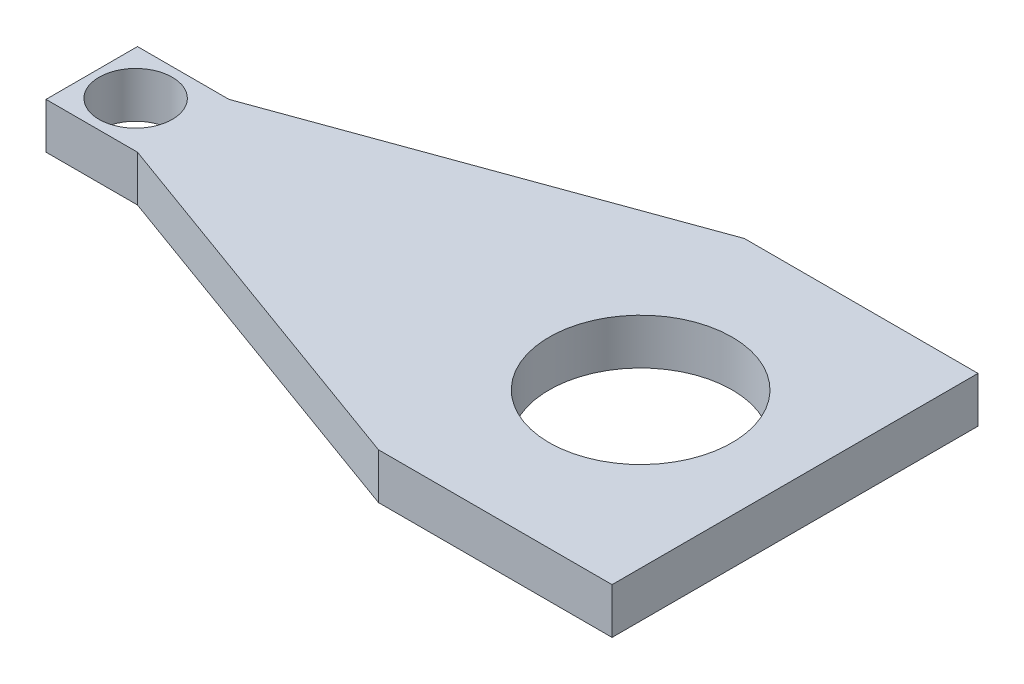
from build123d import *

# Parameters (mm, degrees)
SKETCH1_R           = 1.27
SKETCH1_R_2         = 3.175
BOSS_EXTRUDE1_DEPTH = 1.5875


with BuildPart() as part:
    # Sketch1 → Boss-Extrude1 (new body)
    with BuildSketch(Plane(origin=(0, 0, 0), x_dir=(1, 0, 0), z_dir=(0, 1, 0))):
        Polygon((-19.05, -1.5875), (-15.875, -1.5875), (-2.749630657, -6.35), (5.358013634, -6.35), (5.358013634, 6.35), (-2.749630657, 6.35), (-15.875, 1.5875), (-19.05, 1.5875), align=None)
        with Locations((-17.526, 0)):
            Circle(SKETCH1_R, mode=Mode.SUBTRACT)
        Circle(SKETCH1_R_2, mode=Mode.SUBTRACT)
    extrude(amount=BOSS_EXTRUDE1_DEPTH)


solid = part.part
